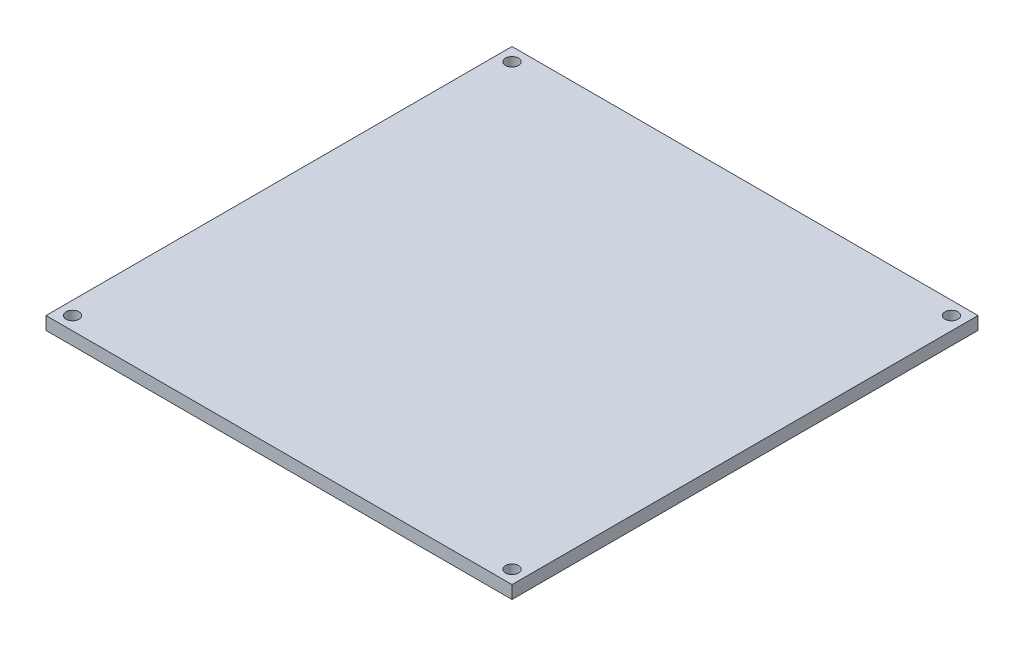
from build123d import *

# Parameters (mm, degrees)
SKETCH1_W           = 72
SKETCH1_H           = 72
SKETCH1_R           = 1
BOSS_EXTRUDE1_DEPTH = 2


with BuildPart() as part:
    # Sketch1 → Boss-Extrude1 (new body)
    with BuildSketch(Plane(origin=(0, 0, 0), x_dir=(1, 0, 0), z_dir=(0, 1, 0))):
        with Locations((0, 17.516265912)):
            Rectangle(SKETCH1_W, SKETCH1_H)
        with Locations((-33.949390335, 51.465656247)):
            Circle(SKETCH1_R, mode=Mode.SUBTRACT)
        with Locations((33.949390335, 51.465656247)):
            Circle(SKETCH1_R, mode=Mode.SUBTRACT)
        with Locations((33.949390335, -16.433124422)):
            Circle(SKETCH1_R, mode=Mode.SUBTRACT)
        with Locations((-33.949390335, -16.433124422)):
            Circle(SKETCH1_R, mode=Mode.SUBTRACT)
    extrude(amount=BOSS_EXTRUDE1_DEPTH)


solid = part.part
